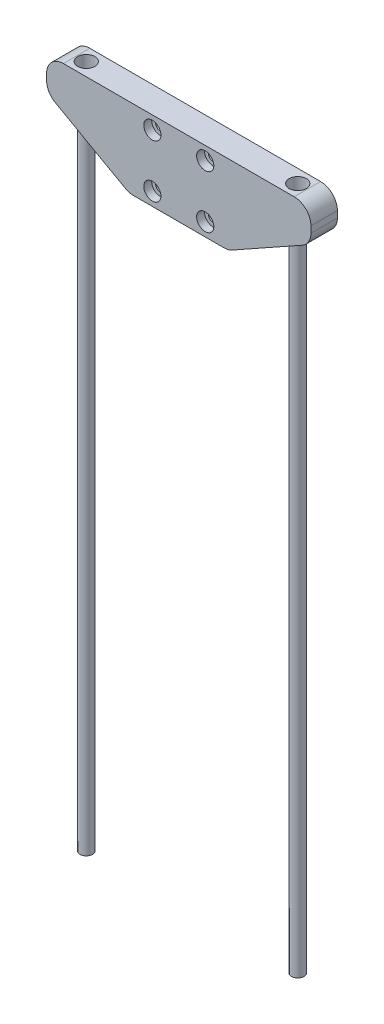
from build123d import *

# Parameters (mm, degrees)
BOSS_EXTRUDE1_DEPTH            = 5
CUT_EXTRUDE1_DEPTH             = 10
SKETCH4_W                      = 2.38125
SKETCH4_H                      = 243.6
SKETCH4_3_W                    = 2.38125
SKETCH4_3_H                    = 243.6
CBORE_FOR_M3_SHCS1_AT_2_COUNT  = 2
CBORE_FOR_M3_SHCS1_AT_2_PITCH  = 20
CBORE_FOR_M3_SHCS1_AT_3_COUNT  = 2
CBORE_FOR_M3_SHCS1_AT_3_PITCH  = 28.284271247
CBORE_FOR_M3_SHCS1_AT_4_COUNT  = 2
CBORE_FOR_M3_SHCS1_AT_4_PITCH  = 20
CBORE_FOR_M3_SHCS2_AT_2_COUNT  = 2
CBORE_FOR_M3_SHCS2_AT_2_PITCH  = 80
M3X0_5_TAPPED_HOLE1_AT_2_COUNT = 2
M3X0_5_TAPPED_HOLE1_AT_2_PITCH = 80
FILLET1_R                      = 6.35


with BuildPart() as part:
    # Sketch3 → Boss-Extrude1 (new, symmetric)
    with BuildSketch(Plane.XY):
        Polygon((-50, 15), (-50, 2.5), (-18.75, -15), (18.75, -15), (50, 2.5), (50, 15), align=None)
    extrude(amount=BOSS_EXTRUDE1_DEPTH, both=True)

    # Sketch10 → Cut-Extrude1 (cut)
    with BuildSketch(Plane(origin=(0, 0, 0), x_dir=(1, 0, 0), z_dir=(0, 1, 0))):
        with BuildLine():
            Line((40, 2.38125), (35, 2.38125))
            ThreePointArc((35, 2.38125), (32.61875, 0), (35, -2.38125))
            Line((35, -2.38125), (40, -2.38125))
            ThreePointArc((40, -2.38125), (42.38125, 0), (40, 2.38125))
        make_face()
        with BuildLine():
            Line((-40, 2.38125), (-35, 2.38125))
            ThreePointArc((-35, 2.38125), (-32.61875, 0), (-35, -2.38125))
            Line((-35, -2.38125), (-40, -2.38125))
            ThreePointArc((-40, -2.38125), (-42.38125, 0), (-40, 2.38125))
        make_face()
    extrude(amount=-CUT_EXTRUDE1_DEPTH, mode=Mode.SUBTRACT)

    # Sketch6 → CBORE for M3 SHCS1 (revolve, cut)
    with BuildSketch(Plane(origin=(-10, 10, 5), x_dir=(0, -1, 0), z_dir=(1, 0, 0))):
        Polygon((0, 0), (0, 8.581549114), (1.8, 7.5), (1.8, 3), (3.25, 3), (3.25, 0), align=None)
    cbore_for_m3_shcs1 = revolve(axis=Axis((-10, 10, 11.35), (0, 0, -1)), mode=Mode.SUBTRACT)

    # CBORE for M3 SHCS1 at 2: CBORE for M3 SHCS1 ×2
    with Locations(*[(0, -i * CBORE_FOR_M3_SHCS1_AT_2_PITCH, 0) for i in range(1, CBORE_FOR_M3_SHCS1_AT_2_COUNT)]):
        add(cbore_for_m3_shcs1, mode=Mode.SUBTRACT)

    # CBORE for M3 SHCS1 at 3: CBORE for M3 SHCS1 ×2
    with Locations(*[Vector(0.7071067811865485, -0.7071067811865467, 0) * (i * CBORE_FOR_M3_SHCS1_AT_3_PITCH) for i in range(1, CBORE_FOR_M3_SHCS1_AT_3_COUNT)]):
        add(cbore_for_m3_shcs1, mode=Mode.SUBTRACT)

    # CBORE for M3 SHCS1 at 4: CBORE for M3 SHCS1 ×2
    with Locations(*[(i * CBORE_FOR_M3_SHCS1_AT_4_PITCH, 0, 0) for i in range(1, CBORE_FOR_M3_SHCS1_AT_4_COUNT)]):
        add(cbore_for_m3_shcs1, mode=Mode.SUBTRACT)

    # Sketch12 → CBORE for M3 SHCS2 (revolve, cut)
    with BuildSketch(Plane(origin=(-40, 15, 0), x_dir=(0, 0, 1), z_dir=(1, 0, 0))):
        Polygon((0, 0), (0, 258.6), (1.8, 258.6), (1.8, 11), (3.25, 11), (3.25, 0), align=None)
    cbore_for_m3_shcs2 = revolve(axis=Axis((-40, 21.35, 0), (0, -1, 0)), mode=Mode.SUBTRACT)

    # CBORE for M3 SHCS2 at 2: CBORE for M3 SHCS2 ×2
    with Locations(*[(i * CBORE_FOR_M3_SHCS2_AT_2_PITCH, 0, 0) for i in range(1, CBORE_FOR_M3_SHCS2_AT_2_COUNT)]):
        add(cbore_for_m3_shcs2, mode=Mode.SUBTRACT)

    # Fillet1
    fillet1_edges = [part.edges().sort_by_distance(p)[0] for p in [
        (-18.75, -15, 0),
        (18.75, -15, 0),
        (50, 2.5, 0),
        (50, 15, 0),
        (-50, 15, 0),
        (-50, 2.5, 0),
    ]]
    fillet(fillet1_edges, radius=FILLET1_R)


with BuildPart() as body_2:
    # Sketch4 → Revolve1 (revolve)
    with BuildSketch(Plane.XY):
        with Locations((-41.190625, -121.8)):
            Rectangle(SKETCH4_W, SKETCH4_H)
    revolve(axis=Axis((-40, -243.6, 0), (0, -1, 0)))

    # Sketch14 → M3x0.5 Tapped Hole1 (revolve, cut)
    with BuildSketch(Plane(origin=(-40, 0, 0), x_dir=(0, 0, 1), z_dir=(1, 0, 0))):
        Polygon((0, 0), (0, 8.251075774), (1.25, 7.5), (1.25, 0), align=None)
    m3x0_5_tapped_hole1 = revolve(axis=Axis((-40, 6.35, 0), (0, -1, 0)), mode=Mode.SUBTRACT)


with BuildPart() as body_3:
    # Sketch4<3> → Revolve2 (revolve)
    with BuildSketch(Plane.XY):
        with Locations((38.809375, -121.8)):
            Rectangle(SKETCH4_3_W, SKETCH4_3_H)
    revolve(axis=Axis((40, -243.6, 0), (0, -1, 0)))

    # M3x0.5 Tapped Hole1 at 2: M3x0.5 Tapped Hole1 ×2
    with Locations(*[(i * M3X0_5_TAPPED_HOLE1_AT_2_PITCH, 0, 0) for i in range(1, M3X0_5_TAPPED_HOLE1_AT_2_COUNT)]):
        add(m3x0_5_tapped_hole1, mode=Mode.SUBTRACT)


solid = Compound([part.part, body_2.part, body_3.part])
